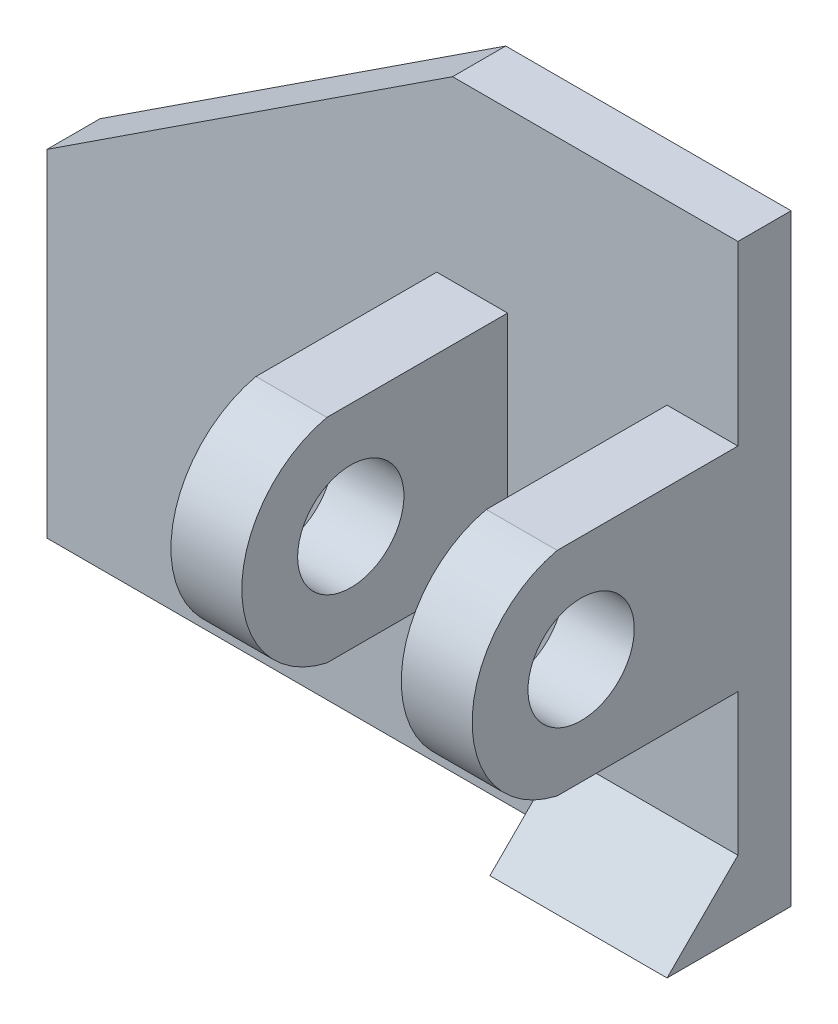
from build123d import *

# Parameters (mm, degrees)
ESBO_O1_W                  = 10
ESBO_O1_H                  = 4
RESSALTO_EXTRUS_O1_DEPTH   = 3
ESBO_O1_8_W                = 4
ESBO_O1_8_H                = 12
RESSALTO_EXTRUS_O2_DEPTH   = 18
CORTE_EXTRUS_O1_DEPTH      = 47.968074263
CORTE_EXTRUS_O1_DEPTH_BACK = 47.968074263
ESBO_O2_R                  = 3
ESBO_O1_9_W                = 10
ESBO_O1_9_H                = 4
RESSALTO_EXTRUS_O3_DEPTH   = 8
CHANFRO1_SIZE              = 5


with BuildPart() as part:
    # Esboço1 → Ressalto-extrusão1 (new body)
    # profile 1 of 2: a face of its own
    with BuildSketch(Plane.XY):
        Polygon((-24.5, -15), (-24.5, -19), (-15.5, -19), (4.5, -19), (4.5, -15), (14.5, -15), (14.5, -7), (10.5, -7), (10.5, 5), (14.5, 5), (14.5, 15), (1.5, 15), (-1.605263158, 15), (-24.5, 0), align=None)
        with BuildLine():
            ThreePointArc((-15.5, -16.5), (-16.560660172, -16.060660172), (-17, -15))
            ThreePointArc((-17, -15), (-15.5, -13.5), (-14, -15))
            ThreePointArc((-14, -15), (-14.439339828, -16.060660172), (-15.5, -16.5))
        make_face(mode=Mode.SUBTRACT)
        Polygon((-2.5, 5), (1.5, 5), (1.5, -7), (-2.5, -7), (-2.5, 0), align=None, mode=Mode.SUBTRACT)
    # profile 2 of 2: a face of its own
    with BuildSketch(Plane.XY):
        with Locations((9.5, -17)):
            Rectangle(ESBO_O1_W, ESBO_O1_H)
    extrude(amount=RESSALTO_EXTRUS_O1_DEPTH)

    # Esboço1<8> → Ressalto-extrusão2 (add)
    with BuildSketch(Plane.XY):
        Polygon((10.5, -7), (14.5, -7), (14.5, -2), (14.5, 5), (10.5, 5), align=None)
        with Locations((-0.5, -1)):
            Rectangle(ESBO_O1_8_W, ESBO_O1_8_H)
    extrude(amount=RESSALTO_EXTRUS_O2_DEPTH)

    # Esboço2 → Corte-extrusão1 (cut, two sides: drawn at the far end of the back side and taken through both)
    with BuildSketch(Plane(origin=(14.5, 0, 0), x_dir=(0, 0, -1), z_dir=(1, 0, 0)).offset(-CORTE_EXTRUS_O1_DEPTH_BACK)):
        with BuildLine():
            ThreePointArc((-18, -1), (-16.652343178, 2.841874542), (-13.2, 5))
            Line((-13.2, 5), (-18, 5))
            Line((-18, 5), (-18, -1))
        make_face()
        with BuildLine():
            ThreePointArc((-13.2, -7), (-16.652343178, -4.841874542), (-18, -1))
            Line((-18, -1), (-18, -7))
            Line((-18, -7), (-13.2, -7))
        make_face()
        with Locations(Location((-11.85, -1, 0), (0, 0, 180))):
            Circle(ESBO_O2_R)
    extrude(amount=CORTE_EXTRUS_O1_DEPTH + CORTE_EXTRUS_O1_DEPTH_BACK, mode=Mode.SUBTRACT)

    # Esboço1<9> → Ressalto-extrusão3 (add)
    with BuildSketch(Plane.XY):
        with Locations((9.5, -17)):
            Rectangle(ESBO_O1_9_W, ESBO_O1_9_H)
    extrude(amount=RESSALTO_EXTRUS_O3_DEPTH)

    # Chanfro1
    # the kernel refuses this chamfer: 5 mm, written as the material it takes off along each edge
    with BuildSketch(Plane(origin=(27.35841494, -15, 8), x_dir=(0, 0.027495876610586317, -0.9996219169112968), z_dir=(-1, 0, 0))) as chanfro1_piece_1_section:
        Polygon((CHANFRO1_SIZE * 0.999621916911, CHANFRO1_SIZE * 0.0274958766106), (-CHANFRO1_SIZE * 0.0274958766106, CHANFRO1_SIZE * 0.999621916911), (0, 0), align=None)
    chanfro1_piece_1 = extrude(amount=35.71682988, mode=Mode.PRIVATE)
    chanfro1_piece_1 = split(chanfro1_piece_1, bisect_by=Plane(origin=(9.5, -16.652020772, 3), z_dir=(0, 0, 1)), keep=Keep.TOP, mode=Mode.PRIVATE)
    add(chanfro1_piece_1, mode=Mode.SUBTRACT)


solid = part.part
